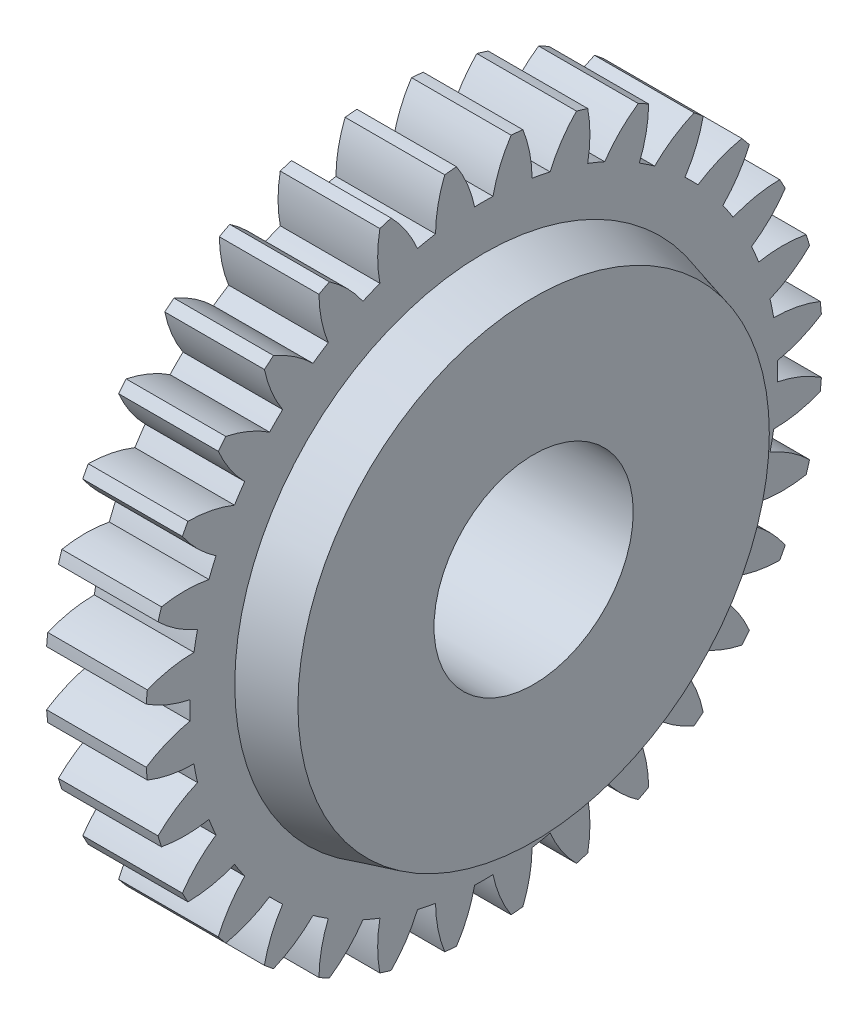
from build123d import *

# Parameters (mm, degrees)
BASPROSKE_W         = 3
BASPROSKE_H         = 10.2
TOOTHCUT_DEPTH      = 15.733634989
TEETHCUTS_COUNT     = 32
TEETHCUTS_ANGLE     = 348.75
SKETCH1_R           = 7.5
BOSS_EXTRUDE1_DEPTH = 1.5
BOSS_EXTRUDE1_TAPER = 15
BORSKE_R            = 3
BORE_DEPTH          = 50.0000508


with BuildPart() as part:
    # BasProSke → Base-Revolve (revolve)
    with BuildSketch(Plane(origin=(0, 0, 0), x_dir=(1, 0, 0), z_dir=(0, 1, 0))):
        with Locations((1.5, 5.1)):
            Rectangle(BASPROSKE_W, BASPROSKE_H)
    revolve(axis=Axis((-10, 0, 0), (1, 0, 0)))

    # TooCutSke → ToothCut (cut, through all)
    with BuildSketch(Plane(origin=(0, 0, 0), x_dir=(0, 0, -1), z_dir=(1, 0, 0))):
        with BuildLine():
            ThreePointArc((0.277462687, 8.844648973), (0, 8.849), (-0.277462687, 8.844648973))
            ThreePointArc((-0.277462687, 8.844648973), (-0.493622187, 9.544691437), (-0.838803227, 10.190937852))
            ThreePointArc((-0.838803227, 10.190937852), (0, 10.2254), (0.838803227, 10.190937852))
            ThreePointArc((0.838803227, 10.190937852), (0.493622187, 9.544691437), (0.277462687, 8.844648973))
        make_face()
    toothcut = extrude(amount=TOOTHCUT_DEPTH, mode=Mode.SUBTRACT)

    # TeethCuts: ToothCut ×32 about axis
    teethcuts_axis = Axis((-10, 0, 0), (1, 0, 0))
    for i in range(1, TEETHCUTS_COUNT):
        add(toothcut.rotate(teethcuts_axis, i * TEETHCUTS_ANGLE / (TEETHCUTS_COUNT - 1)), mode=Mode.SUBTRACT)

    # Sketch1 → Boss-Extrude1 (add)
    with BuildSketch(Plane(origin=(3, 0, 0), x_dir=(0, 0, -1), z_dir=(1, 0, 0))):
        Circle(SKETCH1_R)
    extrude(amount=BOSS_EXTRUDE1_DEPTH, taper=BOSS_EXTRUDE1_TAPER)

    # BorSke → Bore (cut, symmetric)
    with BuildSketch(Plane(origin=(0, 0, 0), x_dir=(0, 0, -1), z_dir=(1, 0, 0))):
        Circle(BORSKE_R)
    extrude(amount=BORE_DEPTH, both=True, mode=Mode.SUBTRACT)


solid = part.part
